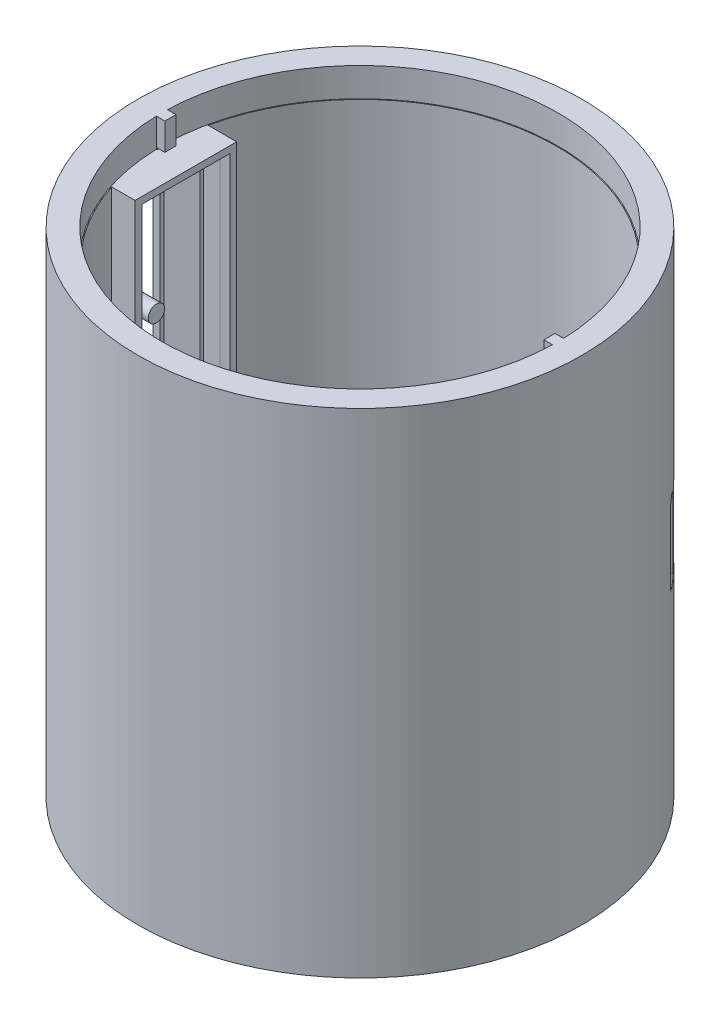
from build123d import *
from OCP.BRepFilletAPI import BRepFilletAPI_MakeChamfer
from build123d.topology import SkipClean

# Parameters (mm, degrees)
SKETCH2_R                 = 27
SKETCH2_R_2               = 24
BOSS_EXTRUDE4_DEPTH       = 60
SKETCH3_R                 = 27
SKETCH3_R_2               = 4
BOSS_EXTRUDE2_DEPTH       = 2
CUT_EXTRUDE1_DEPTH        = 70.440622
CUT_EXTRUDE1_DEPTH_BACK   = 70.440622
SKETCH7_R                 = 18.75
SKETCH7_R_2               = 14.25
SKETCH4_W                 = 8
SKETCH4_H                 = 4.3
SERVO_MOUNT_DEPTH         = 7
SKETCH31_R                = 0.9
BOSS_EXTRUDE16_DEPTH      = 4
SKETCH8_W                 = 10
SKETCH8_H                 = 10
BOSS_EXTRUDE6_DEPTH       = 2
CUT_EXTRUDE14_START       = 2.8
SKETCH32_R                = 1.9
CUT_EXTRUDE14_DEPTH       = 0.4
BOSS_EXTRUDE8_START       = -4.5
SKETCH12_W                = 4
SKETCH12_H                = 1
BOSS_EXTRUDE8_DEPTH       = 51.1
SKETCH13_W                = 4.3
SKETCH13_H                = 12.35
BOSS_EXTRUDE9_DEPTH       = 1
BOSS_EXTRUDE10_START      = -4
SKETCH14_W                = 12.35
SKETCH14_H                = 52.1
BOSS_EXTRUDE10_DEPTH      = 1
CUT_EXTRUDE4_START        = -20
CUT_EXTRUDE4_DEPTH        = 10
CHAMFER1_SIZE             = 3.062608
CHAMFER1_SIZE_2           = 1.3
BOSS_EXTRUDE11_DEPTH      = 2.5
BOSS_EXTRUDE11_DEPTH_BACK = 1.5
SKETCH15_R                = 1
SKETCH16_W                = 1.9
SKETCH16_H                = 1.35
BOSS_EXTRUDE12_DEPTH      = 3.3
BOSS_EXTRUDE13_DEPTH      = 10
FILLET1_R                 = 3
CUT_EXTRUDE10_DEPTH       = 70.440622
CUT_EXTRUDE10_DEPTH_BACK  = 70.440622
SKETCH23_R                = 7.5
BOSS_EXTRUDE14_REACH      = 86.526
BOSS_EXTRUDE14_END_RADIUS = 27
CUT_EXTRUDE11_DEPTH       = 3.5
FILLET5_R                 = 5
FILLET6_R                 = 0.2
CUT_EXTRUDE15_DEPTH       = 10
CUT_EXTRUDE15_DEPTH_BACK  = 10
FILLET7_R                 = 0.5
CHAMFER2_SIZE             = 1
CHAMFER2_SIZE2            = 0.176327


with BuildPart() as part:
    # Sketch2 → Boss-Extrude4 (new body)
    with BuildSketch(Plane(origin=(0, 0, 0), x_dir=(1, 0, 0), z_dir=(0, 1, 0))):
        with Locations(Location((0, 0, 0), (0, 0, 270))):
            Circle(SKETCH2_R)
        with Locations(Location((0, 0, 0), (0, 0, 270))):
            Circle(SKETCH2_R_2, mode=Mode.SUBTRACT)
    extrude(amount=BOSS_EXTRUDE4_DEPTH)

    # Sketch3 → Boss-Extrude2 (add)
    with BuildSketch(Plane(origin=(0, 0, 0), x_dir=(1, 0, 0), z_dir=(0, 1, 0))):
        with Locations(Location((0, 0, 0), (0, 0, 270))):
            Circle(SKETCH3_R)
        with Locations(Location((0, 0, 0), (0, 0, 270))):
            Circle(SKETCH3_R_2, mode=Mode.SUBTRACT)
        with BuildLine():
            Line((12.925266, -6), (17.764079, -6))
            ThreePointArc((17.764079, -6), (-18.75, 0), (17.764079, 6))
            Line((17.764079, 6), (12.925266, 6))
            ThreePointArc((12.925266, 6), (-14.25, 0), (12.925266, -6))
        make_face(mode=Mode.SUBTRACT)
    extrude(amount=BOSS_EXTRUDE2_DEPTH)

    # Sketch7 → Cut-Extrude1 (cut, two sides: drawn at the far end of the back side and taken through both)
    with BuildSketch(Plane(origin=(0, 2, 0), x_dir=(1, 0, 0), z_dir=(0, 1, 0)).offset(-CUT_EXTRUDE1_DEPTH_BACK)):
        with Locations(Location((0, 0, 0), (0, 0, 270))):
            Circle(SKETCH7_R)
        with Locations(Location((0, 0, 0), (0, 0, 270))):
            Circle(SKETCH7_R_2, mode=Mode.SUBTRACT)
    extrude(amount=CUT_EXTRUDE1_DEPTH + CUT_EXTRUDE1_DEPTH_BACK, mode=Mode.SUBTRACT)


with BuildPart() as cut_extrude1_piece_1:
    # of the separate pieces the step leaves, piece 1, a body of its own (cut_extrude1_pieces)
    add(part.part.solids().sort_by_distance((0, 0, 27))[0])



with BuildPart() as cut_extrude1_piece_2:
    # of the separate pieces the step leaves, piece 2, a body of its own (cut_extrude1_pieces)
    add(part.part.solids().sort_by_distance((12.925266, 0, 6))[0])


with BuildPart() as cut_extrude1_piece_1_1:
    add(cut_extrude1_piece_1.part)

    add(cut_extrude1_piece_2.part)  # Servo_Mount merges Cut-Extrude1 piece 2
    # Sketch4 → Servo_Mount (add)
    with BuildSketch(Plane.XZ.offset(-2)):
        with Locations((0, 19.6)):
            Rectangle(SKETCH4_W, SKETCH4_H)
        with Locations((0, -8.2)):
            Rectangle(SKETCH4_W, SKETCH4_H)
    extrude(amount=-SERVO_MOUNT_DEPTH)

    # Sketch31 → Boss-Extrude16 (add)
    with BuildSketch(Plane(origin=(0, 9, 0), x_dir=(1, 0, 0), z_dir=(0, 1, 0))):
        with Locations(Location((0, 8.15, 0), (0, 0, 270))):
            Circle(SKETCH31_R)
        with Locations(Location((0, -19.55, 0), (0, 0, 270))):
            Circle(SKETCH31_R)
    extrude(amount=BOSS_EXTRUDE16_DEPTH)

    # Sketch8 → Boss-Extrude6 (add)
    with BuildSketch(Plane(origin=(0, 2, 0), x_dir=(1, 0, 0), z_dir=(0, 1, 0))):
        with Locations((0, -16)):
            Rectangle(SKETCH8_W, SKETCH8_H)
    extrude(amount=-BOSS_EXTRUDE6_DEPTH)

    # Sketch32 → Cut-Extrude14 (cut)
    # profile 1 of 2: a face of its own
    with SkipClean():  # the faces are left unmerged after this step: merging them gives an invalid solid
        with BuildSketch(Plane(origin=(0, 9, 0), x_dir=(1, 0, 0), z_dir=(0, 1, 0)).offset(CUT_EXTRUDE14_START)):
            with Locations((0, -19.55)):
                Circle(SKETCH32_R)
            with BuildLine():
                Line((-0.855336, -19.27), (0.855336, -19.27))
                ThreePointArc((0.855336, -19.27), (0.9, -19.55), (0.855336, -19.83))
                Line((0.855336, -19.83), (-0.855336, -19.83))
                ThreePointArc((-0.855336, -19.83), (-0.9, -19.55), (-0.855336, -19.27))
            make_face(mode=Mode.SUBTRACT)
        # profile 2 of 2: a face of its own
        with BuildSketch(Plane(origin=(0, 9, 0), x_dir=(1, 0, 0), z_dir=(0, 1, 0)).offset(CUT_EXTRUDE14_START)):
            with Locations((0, 8.15)):
                Circle(SKETCH32_R)
            with BuildLine():
                Line((-0.855336, 8.43), (0.855336, 8.43))
                ThreePointArc((0.855336, 8.43), (0.9, 8.15), (0.855336, 7.87))
                Line((0.855336, 7.87), (-0.855336, 7.87))
                ThreePointArc((-0.855336, 7.87), (-0.9, 8.15), (-0.855336, 8.43))
            make_face(mode=Mode.SUBTRACT)
        extrude(amount=CUT_EXTRUDE14_DEPTH, mode=Mode.SUBTRACT)

    # Sketch12 → Boss-Extrude8 (add)
    with SkipClean():  # the faces are left unmerged after this step: merging them gives an invalid solid
        with BuildSketch(Plane(origin=(0, 60, 0), x_dir=(1, 0, 0), z_dir=(0, 1, 0)).offset(BOSS_EXTRUDE8_START)):
            with Locations((-22, -6.85)):
                Rectangle(SKETCH12_W, SKETCH12_H)
            with Locations((-22, 4.5)):
                Rectangle(SKETCH12_W, SKETCH12_H)
        extrude(amount=-BOSS_EXTRUDE8_DEPTH)

    # Sketch13 → Boss-Extrude9 (add)
    with SkipClean():  # the faces are left unmerged after this step: merging them gives an invalid solid
        with BuildSketch(Plane(origin=(0, 55.5, 0), x_dir=(1, 0, 0), z_dir=(0, 1, 0))):
            with Locations((-22.15, -1.175)):
                Rectangle(SKETCH13_W, SKETCH13_H)
        extrude(amount=BOSS_EXTRUDE9_DEPTH)

    # Sketch14 → Boss-Extrude10 (add)
    with SkipClean():  # the faces are left unmerged after this step: merging them gives an invalid solid
        with BuildSketch(Plane(origin=(-20, 0, 0), x_dir=(0, 0, -1), z_dir=(1, 0, 0)).offset(BOSS_EXTRUDE10_START)):
            with Locations((-1.175, 30.45)):
                Rectangle(SKETCH14_W, SKETCH14_H)
        extrude(amount=BOSS_EXTRUDE10_DEPTH)

    # Sketch11 → Cut-Extrude4 (cut)
    with SkipClean():  # the faces are left unmerged after this step: merging them gives an invalid solid
        with BuildSketch(Plane(origin=(0, 0, 0), x_dir=(0, 0, -1), z_dir=(1, 0, 0)).offset(CUT_EXTRUDE4_START)):
            with BuildLine():
                Line((1.25, 54.7), (-1.25, 54.7))
                ThreePointArc((-1.25, 54.7), (-1.957107, 54.407107), (-2.25, 53.7))
                Line((-2.25, 53.7), (-2.25, 6.3))
                ThreePointArc((-2.25, 6.3), (-1.957107, 5.592893), (-1.25, 5.3))
                Line((-1.25, 5.3), (1.25, 5.3))
                ThreePointArc((1.25, 5.3), (1.957107, 5.592893), (2.25, 6.3))
                Line((2.25, 6.3), (2.25, 53.7))
                ThreePointArc((2.25, 53.7), (1.957107, 54.407107), (1.25, 54.7))
            make_face()
        extrude(amount=-CUT_EXTRUDE4_DEPTH, mode=Mode.SUBTRACT)

    # Chamfer1
    # the kernel refuses this chamfer: 3.062608, 1.3 mm, written as the material it takes off along each edge
    with BuildSketch(Plane(origin=(-23, 5.3, 1.25), x_dir=(-0.9998864034585261, 0.015072497429863337, 0), z_dir=(0, 0, -1))) as chamfer1_piece_1:
        Polygon((CHAMFER1_SIZE * 0.999886403318, -CHAMFER1_SIZE * 0.0150724974278), (-CHAMFER1_SIZE_2 * 0.0150724974299, -CHAMFER1_SIZE_2 * 0.999886403459), (0, 0), align=None)
    extrude(amount=2.5, mode=Mode.SUBTRACT)
    with BuildSketch(Plane(origin=(-23, 6.3, -1.25), x_dir=(0, -1, 0), z_dir=(0, 0, 1))) as chamfer1_piece_2:
        Polygon((1, -CHAMFER1_SIZE), (1 + CHAMFER1_SIZE_2, 0), (1, 0), align=None)
    revolve(axis=Axis((-23, 6.3, -1.25), (1, 0, 0)), revolution_arc=90, mode=Mode.SUBTRACT)
    with BuildSketch(Plane(origin=(-23, 6.3, -2.25), x_dir=(-0.9998864034585261, 0, 0.015072497429863618), z_dir=(0, 1, 0)), Plane(origin=(-23, 53.7, 2.25), x_dir=(-0.9998864034585261, 0, -0.015072497429863618), z_dir=(0, -1, 0))) as chamfer1_piece_3:
        Polygon((CHAMFER1_SIZE * 0.999886403318, -CHAMFER1_SIZE * 0.0150724974278), (-CHAMFER1_SIZE_2 * 0.0150724974299, -CHAMFER1_SIZE_2 * 0.999886403459), (0, 0), align=None)
    extrude(amount=47.4, mode=Mode.SUBTRACT)
    with BuildSketch(Plane(origin=(-23, 53.7, -1.25), x_dir=(0, 0, -1), z_dir=(0, -1, 0))) as chamfer1_piece_4_section:
        Polygon((1, -CHAMFER1_SIZE), (1 + CHAMFER1_SIZE_2, 0), (1, 0), align=None)
    chamfer1_piece_4 = revolve(axis=Axis((-23, 53.7, -1.25), (1, 0, 0)), revolution_arc=90, mode=Mode.PRIVATE)
    chamfer1_piece_4 = split(chamfer1_piece_4, bisect_by=Plane(origin=(-23.978567, 55.5, -2.22545), z_dir=(0, -1, 0)), keep=Keep.TOP, mode=Mode.PRIVATE)
    add(chamfer1_piece_4, mode=Mode.SUBTRACT)
    with BuildSketch(Plane(origin=(-23, 54.7, -1.25), x_dir=(-0.9998864034585261, -0.015072497429863897, 0), z_dir=(0, 0, 1))) as chamfer1_piece_5_section:
        Polygon((CHAMFER1_SIZE * 0.999886403318, -CHAMFER1_SIZE * 0.0150724974278), (-CHAMFER1_SIZE_2 * 0.0150724974299, -CHAMFER1_SIZE_2 * 0.999886403459), (0, 0), align=None)
    chamfer1_piece_5 = extrude(amount=2.5, mode=Mode.PRIVATE)
    chamfer1_piece_5 = split(chamfer1_piece_5, bisect_by=Plane(origin=(-24.172263, 55.5, 0), z_dir=(0, -1, 0)), keep=Keep.TOP, mode=Mode.PRIVATE)
    add(chamfer1_piece_5, mode=Mode.SUBTRACT)
    with BuildSketch(Plane(origin=(-23, 53.7, 1.25), x_dir=(0, 1, 0), z_dir=(0, 0, -1))) as chamfer1_piece_6_section:
        Polygon((1, -CHAMFER1_SIZE), (1 + CHAMFER1_SIZE_2, 0), (1, 0), align=None)
    chamfer1_piece_6 = revolve(axis=Axis((-23, 53.7, 1.25), (1, 0, 0)), revolution_arc=90, mode=Mode.PRIVATE)
    chamfer1_piece_6 = split(chamfer1_piece_6, bisect_by=Plane(origin=(-23.978567, 55.5, 2.22545), z_dir=(0, -1, 0)), keep=Keep.TOP, mode=Mode.PRIVATE)
    add(chamfer1_piece_6, mode=Mode.SUBTRACT)
    with BuildSketch(Plane(origin=(-23, 6.3, 1.25), x_dir=(0, 0, 1), z_dir=(0, 1, 0))) as chamfer1_piece_7:
        Polygon((1, -CHAMFER1_SIZE), (1 + CHAMFER1_SIZE_2, 0), (1, 0), align=None)
    revolve(axis=Axis((-23, 6.3, 1.25), (1, 0, 0)), revolution_arc=90, mode=Mode.SUBTRACT)

    # Sketch15 → Boss-Extrude11 (add, two sides: drawn at the far end of the back side and taken through both)
    with BuildSketch(Plane(origin=(-23, 0, 0), x_dir=(0, 0, -1), z_dir=(1, 0, 0)).offset(-BOSS_EXTRUDE11_DEPTH_BACK)):
        with Locations((-4.25, 42.795)):
            Circle(SKETCH15_R)
        with Locations((-4.25, 17.395)):
            Circle(SKETCH15_R)
    extrude(amount=BOSS_EXTRUDE11_DEPTH + BOSS_EXTRUDE11_DEPTH_BACK)

    # Sketch16 → Boss-Extrude12 (add)
    with BuildSketch(Plane(origin=(0, 60, 0), x_dir=(1, 0, 0), z_dir=(0, 1, 0))):
        with Locations((-24, 0)):
            Rectangle(SKETCH16_W, SKETCH16_H)
        with Locations((24, 0)):
            Rectangle(SKETCH16_W, SKETCH16_H)
    extrude(amount=-BOSS_EXTRUDE12_DEPTH)

    # Sketch17 → Boss-Extrude13 (add)
    with BuildSketch(Plane(origin=(0, 2, 0), x_dir=(1, 0, 0), z_dir=(0, 1, 0))):
        Polygon((21.523678, 13.08692), (18.137087, 9.455246), (17.405733, 10.137244), (20.133727, 13.062659), (13.062659, 20.133727), (10.137244, 17.405733), (9.455246, 18.137087), (13.08692, 21.523678), align=None)
        Polygon((-17.405733, -10.137244), (-18.137087, -9.455246), (-21.523678, -13.08692), (-13.08692, -21.523678), (-9.455246, -18.137087), (-10.137244, -17.405733), (-13.062659, -20.133727), (-20.133727, -13.062659), align=None)
    extrude(amount=BOSS_EXTRUDE13_DEPTH)

    # Fillet1
    # the kernel refuses this fillet: 3 mm, written as the material it adds along each edge
    with BuildSketch(Plane(origin=(0, 12, 0), x_dir=(0.8389052741096091, 0, -0.5442774486152091), z_dir=(-0.5442774486152091, 0, -0.8389052741096091))) as fillet1_piece_1_section:
        with BuildLine():
            CenterArc((24 - FILLET1_R, -FILLET1_R), FILLET1_R, 0, 90)
            Line((24 - FILLET1_R, 0), (24, 0))
            Line((24, 0), (24, -FILLET1_R))
        make_face()
    fillet1_piece_1 = revolve(axis=Axis((0, 12, 0), (0, -1, 0)), revolution_arc=20.379728, mode=Mode.PRIVATE)
    fillet1_piece_1 = split(fillet1_piece_1, bisect_by=Plane(origin=(19.567666, 12.669453, -12.455633), z_dir=(0.7313537016191692, 0, 0.6819983600624998)), keep=Keep.TOP, mode=Mode.PRIVATE)
    fillet1_piece_1 = split(fillet1_piece_1, bisect_by=Plane(origin=(20.29902, 12.669453, -11.773635), z_dir=(-0.7313537016191691, 0, -0.6819983600624999)), keep=Keep.TOP, mode=Mode.PRIVATE)
    add(fillet1_piece_1)
    with BuildSketch(Plane(origin=(0, 12, 0), x_dir=(0.21806783687871592, 0, -0.9759336137868383), z_dir=(-0.9759336137868383, 0, -0.21806783687871592))) as fillet1_piece_2_section:
        with BuildLine():
            CenterArc((24 - FILLET1_R, -FILLET1_R), FILLET1_R, 0, 90)
            Line((24 - FILLET1_R, 0), (24, 0))
            Line((24, 0), (24, -FILLET1_R))
        make_face()
    fillet1_piece_2 = revolve(axis=Axis((0, 12, 0), (0, -1, 0)), revolution_arc=20.379728, mode=Mode.PRIVATE)
    fillet1_piece_2 = split(fillet1_piece_2, bisect_by=Plane(origin=(11.773635, 12.669454, -20.29902), z_dir=(0.6819983600624979, 0, 0.7313537016191711)), keep=Keep.TOP, mode=Mode.PRIVATE)
    fillet1_piece_2 = split(fillet1_piece_2, bisect_by=Plane(origin=(12.455633, 12.669454, -19.567666), z_dir=(-0.6819983600624974, 0, -0.7313537016191717)), keep=Keep.TOP, mode=Mode.PRIVATE)
    add(fillet1_piece_2)
    with BuildSketch(Plane(origin=(0, 12, 0), x_dir=(-0.83890527410961, 0, 0.5442774486152078), z_dir=(0.5442774486152078, 0, 0.83890527410961))) as fillet1_piece_3_section:
        with BuildLine():
            CenterArc((24 - FILLET1_R, -FILLET1_R), FILLET1_R, 0, 90)
            Line((24 - FILLET1_R, 0), (24, 0))
            Line((24, 0), (24, -FILLET1_R))
        make_face()
    fillet1_piece_3 = revolve(axis=Axis((0, 12, 0), (0, -1, 0)), revolution_arc=20.379728, mode=Mode.PRIVATE)
    fillet1_piece_3 = split(fillet1_piece_3, bisect_by=Plane(origin=(-19.835935, 12.93384, 12.743317), z_dir=(-0.7313537016191614, 0, -0.6819983600625084)), keep=Keep.TOP, mode=Mode.PRIVATE)
    fillet1_piece_3 = split(fillet1_piece_3, bisect_by=Plane(origin=(-20.567289, 12.93384, 12.061318), z_dir=(0.7313537016191639, 0, 0.6819983600625056)), keep=Keep.TOP, mode=Mode.PRIVATE)
    add(fillet1_piece_3)
    with BuildSketch(Plane(origin=(0, 12, 0), x_dir=(-0.21806783687871747, 0, 0.9759336137868381), z_dir=(0.9759336137868381, 0, 0.21806783687871747))) as fillet1_piece_4_section:
        with BuildLine():
            CenterArc((24 - FILLET1_R, -FILLET1_R), FILLET1_R, 0, 90)
            Line((24 - FILLET1_R, 0), (24, 0))
            Line((24, 0), (24, -FILLET1_R))
        make_face()
    fillet1_piece_4 = revolve(axis=Axis((0, 12, 0), (0, -1, 0)), revolution_arc=20.379728, mode=Mode.PRIVATE)
    fillet1_piece_4 = split(fillet1_piece_4, bisect_by=Plane(origin=(-11.773635, 12.669453, 20.29902), z_dir=(-0.6819983600624926, 0, -0.731353701619176)), keep=Keep.TOP, mode=Mode.PRIVATE)
    fillet1_piece_4 = split(fillet1_piece_4, bisect_by=Plane(origin=(-12.455633, 12.669453, 19.567666), z_dir=(0.6819983600624925, 0, 0.7313537016191761)), keep=Keep.TOP, mode=Mode.PRIVATE)
    add(fillet1_piece_4)

    # Sketch23 → Cut-Extrude10 (cut, two sides: drawn at the far end of the back side and taken through both)
    with BuildSketch(Plane(origin=(0, 2, 0), x_dir=(1, 0, 0), z_dir=(0, 1, 0)).offset(-CUT_EXTRUDE10_DEPTH_BACK)):
        with Locations((-12.639733, 10.605996)):
            Circle(SKETCH23_R)
    extrude(amount=CUT_EXTRUDE10_DEPTH + CUT_EXTRUDE10_DEPTH_BACK, mode=Mode.SUBTRACT)

    # Boss-Extrude14: up to this cylinder (the profile starts inside it)
    boss_extrude14_end = Plane(origin=(0, 30, 0), z_dir=(0, -1, 0)) * Cylinder(BOSS_EXTRUDE14_END_RADIUS, 228.052, mode=Mode.PRIVATE)
    # Sketch24 → Boss-Extrude14 (add, up to the surface)
    with BuildSketch(Plane(origin=(-26.062608, 0, 0), x_dir=(0, 0, -1), z_dir=(1, 0, 0)), mode=Mode.PRIVATE) as boss_extrude14_sk1:
        with BuildLine():
            Line((1.25, 5.3), (-1.25, 5.3))
            ThreePointArc((-1.25, 5.3), (-1.957107, 5.592893), (-2.25, 6.3))
            Line((-2.25, 6.3), (-2.25, 53.7))
            ThreePointArc((-2.25, 53.7), (-1.957107, 54.407107), (-1.25, 54.7))
            Line((-1.25, 54.7), (1.25, 54.7))
            ThreePointArc((1.25, 54.7), (1.957107, 54.407107), (2.25, 53.7))
            Line((2.25, 53.7), (2.25, 6.3))
            ThreePointArc((2.25, 6.3), (1.957107, 5.592893), (1.25, 5.3))
        make_face()
        with BuildLine():
            Line((-1.25, 54.2), (1.25, 54.2))
            ThreePointArc((1.25, 54.2), (1.603553, 54.053553), (1.75, 53.7))
            Line((1.75, 53.7), (1.75, 6.3))
            ThreePointArc((1.75, 6.3), (1.603553, 5.946447), (1.25, 5.8))
            Line((1.25, 5.8), (-1.25, 5.8))
            ThreePointArc((-1.25, 5.8), (-1.603553, 5.946447), (-1.75, 6.3))
            Line((-1.75, 6.3), (-1.75, 53.7))
            ThreePointArc((-1.75, 53.7), (-1.603553, 54.053553), (-1.25, 54.2))
        make_face(mode=Mode.SUBTRACT)
    boss_extrude14_tool1 = extrude(boss_extrude14_sk1.sketch, amount=-BOSS_EXTRUDE14_REACH, mode=Mode.PRIVATE) & boss_extrude14_end
    add(boss_extrude14_tool1.solids().sort_by_distance((-26.062608, 30, -1.753955))[0])

    # Sketch27 → Cut-Extrude11 (cut)
    with BuildSketch(Plane(origin=(0, 60, 0), x_dir=(1, 0, 0), z_dir=(0, 1, 0))):
        with BuildLine():
            Line((-23.05, -0.675), (-23.05, 0.675))
            Line((-23.05, 0.675), (-24.090545, 0.675))
            ThreePointArc((-24.090545, 0.675), (0, 24.1), (24.090545, 0.675))
            Line((24.090545, 0.675), (23.05, 0.675))
            Line((23.05, 0.675), (23.05, -0.675))
            Line((23.05, -0.675), (24.090545, -0.675))
            ThreePointArc((24.090545, -0.675), (0, -24.1), (-24.090545, -0.675))
            Line((-24.090545, -0.675), (-23.05, -0.675))
        make_face()
    extrude(amount=-CUT_EXTRUDE11_DEPTH, mode=Mode.SUBTRACT)

    # Fillet5
    fillet5_edges = [cut_extrude1_piece_1_1.edges().sort_by_distance(p)[0] for p in [
        (-17.975026, 1, -5.33488),
        (-8.375162, 1, -16.775552),
        (-5.572017, 1, -13.115454),
        (-13.883771, 1, -3.209891),
    ]]
    fillet(fillet5_edges, radius=FILLET5_R)

    # Fillet6
    fillet6_edges = [cut_extrude1_piece_1_1.edges().sort_by_distance(p)[0] for p in [
        (-0.855336, 12, 19.83),
        (0.855336, 12, 19.83),
        (0.855336, 12, 19.27),
        (-0.855336, 12, 19.27),
        (-0.855336, 12, -7.87),
        (0.855336, 12, -7.87),
        (0.855336, 12, -8.43),
        (-0.855336, 12, -8.43),
    ]]
    fillet(fillet6_edges, radius=FILLET6_R)

    # Sketch33 → Cut-Extrude15 (cut, two sides: drawn at the far end of the back side and taken through both)
    with BuildSketch(Plane(origin=(16.598193, 0, -16.598193), x_dir=(0.707106781186544, 0, 0.7071067811865511), z_dir=(-0.7071067811865511, 0, 0.707106781186544)).offset(-CUT_EXTRUDE15_DEPTH_BACK)):
        with BuildLine():
            Line((-0.6, 25), (-0.6, 33))
            ThreePointArc((-0.6, 33), (0, 33.6), (0.6, 33))
            Line((0.6, 33), (0.6, 25))
            ThreePointArc((0.6, 25), (0, 24.4), (-0.6, 25))
        make_face()
        with BuildLine():
            Line((2.2, 25), (2.2, 33))
            ThreePointArc((2.2, 33), (2.8, 33.6), (3.4, 33))
            Line((3.4, 33), (3.4, 25))
            ThreePointArc((3.4, 25), (2.8, 24.4), (2.2, 25))
        make_face()
        with BuildLine():
            Line((-3.4, 25), (-3.4, 33))
            ThreePointArc((-3.4, 33), (-2.8, 33.6), (-2.2, 33))
            Line((-2.2, 33), (-2.2, 25))
            ThreePointArc((-2.2, 25), (-2.8, 24.4), (-3.4, 25))
        make_face()
    extrude(amount=CUT_EXTRUDE15_DEPTH + CUT_EXTRUDE15_DEPTH_BACK, mode=Mode.SUBTRACT)

    # Fillet7
    fillet7_edges = [cut_extrude1_piece_1_1.edges().sort_by_distance(p)[0] for p in [
        (19.511433, 29, -18.662904),
        (19.511433, 29, -18.662904),
        (18.662904, 29, -19.511433),
        (19.091883, 24.4, -19.091883),
        (17.472765, 29, -20.584035),
        (17.472765, 29, -20.584035),
        (16.535742, 29, -21.344068),
        (17.00868, 24.4, -20.969139),
        (21.344068, 29, -16.535742),
        (21.344068, 29, -16.535742),
        (20.584035, 29, -17.472765),
        (20.969139, 24.4, -17.00868),
    ]]
    fillet(fillet7_edges, radius=FILLET7_R)

    # Chamfer2: one chamfer whose edges measure the first distance from different faces: ONE call of the kernel's chamfer builder (chamfer() names one face for all edges)
    chamfer2_edges_1 = [cut_extrude1_piece_1_1.edges().sort_by_distance(p)[0] for p in [
        (-20, 29.95, 6.35),
    ]]
    chamfer2_side_1 = [cut_extrude1_piece_1_1.faces().sort_by_distance(p)[0] for p in [
        (-21.5, 29.95, 6.35),
    ]]
    chamfer2_edges_2 = [cut_extrude1_piece_1_1.edges().sort_by_distance(p)[0] for p in [
        (-20, 29.95, -4),
    ]]
    chamfer2_side_2 = [cut_extrude1_piece_1_1.faces().sort_by_distance(p)[0] for p in [
        (-21.5, 29.95, -4),
    ]]
    chamfer2_edges_3 = [cut_extrude1_piece_1_1.edges().sort_by_distance(p)[0] for p in [
        (-20, 55.5, 1.175),
    ]]
    chamfer2_side_3 = [cut_extrude1_piece_1_1.faces().sort_by_distance(p)[0] for p in [
        (-21.789124, 55.5, 1.008181),
    ]]
    chamfer2 = BRepFilletAPI_MakeChamfer(cut_extrude1_piece_1_1.part.solid().wrapped)
    for e in chamfer2_edges_1:
        chamfer2.Add(CHAMFER2_SIZE, CHAMFER2_SIZE2, e.wrapped, chamfer2_side_1[0].wrapped)  # the first distance lies on this face
    for e in chamfer2_edges_2:
        chamfer2.Add(CHAMFER2_SIZE, CHAMFER2_SIZE2, e.wrapped, chamfer2_side_2[0].wrapped)  # the first distance lies on this face
    for e in chamfer2_edges_3:
        chamfer2.Add(CHAMFER2_SIZE, CHAMFER2_SIZE2, e.wrapped, chamfer2_side_3[0].wrapped)  # the first distance lies on this face
    add(Compound.cast(chamfer2.Shape()), mode=Mode.REPLACE)


solid = cut_extrude1_piece_1_1.part
